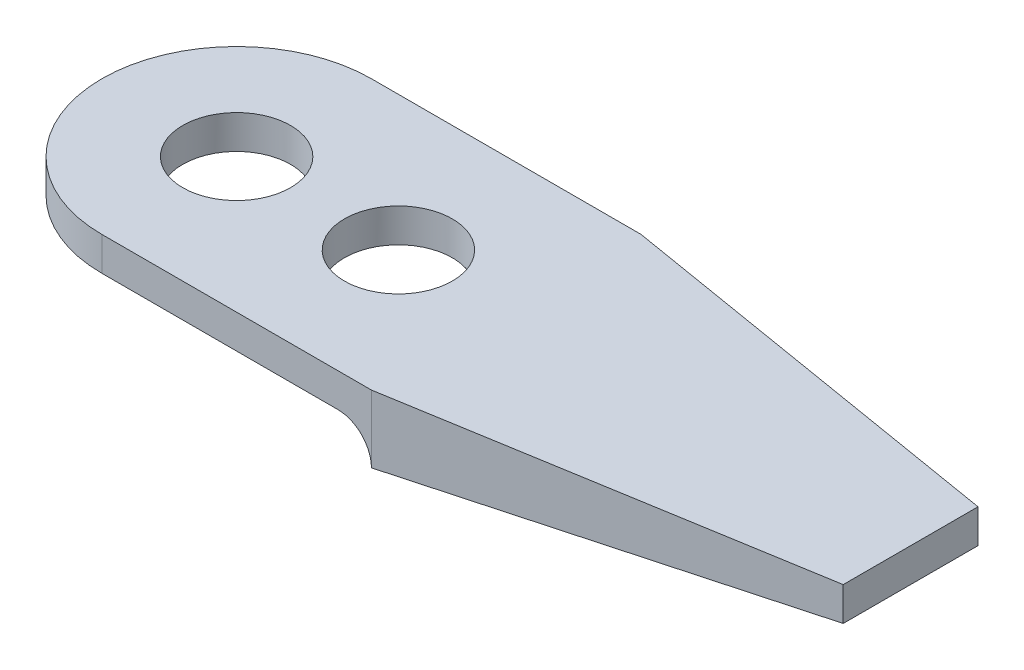
from build123d import *

# Parameters (mm, degrees)
BOSS_EXTRUDE1_DEPTH = 6.35
CUT_EXTRUDE1_DEPTH  = 12.7
FILLET1_R           = 6.35
FILLET2_R           = 1.5875
SKETCH3_R           = 2.54
CUT_EXTRUDE2_DEPTH  = 12.7


with BuildPart() as part:
    # Sketch1 → Boss-Extrude1 (new, symmetric)
    with BuildSketch(Plane.XY):
        Polygon((-19.05, 0), (19.05, 0), (19.05, -1.5875), (0, -3.175), (0, -1.5875), (-19.05, -1.5875), align=None)
    extrude(amount=BOSS_EXTRUDE1_DEPTH, both=True)

    # Sketch2 → Cut-Extrude1 (cut)
    with BuildSketch(Plane(origin=(0, 0, 0), x_dir=(1, 0, 0), z_dir=(0, 1, 0))):
        Polygon((0, 6.35), (19.05, 3.175), (19.05, 6.35), align=None)
    cut_extrude1 = extrude(amount=-CUT_EXTRUDE1_DEPTH, mode=Mode.SUBTRACT)

    # Mirror1: Cut-Extrude1 across plane
    add(cut_extrude1.mirror(Plane.XY), mode=Mode.SUBTRACT)

    # Fillet1
    fillet1_edges = [part.edges().sort_by_distance(p)[0] for p in [
        (-19.05, -0.79375, -6.35),
        (-19.05, -0.79375, 6.35),
    ]]
    fillet(fillet1_edges, radius=FILLET1_R - 0.0001)  # a hair under: the kernel refuses the full size

    # Fillet2
    fillet2_edges = [part.edges().sort_by_distance(p)[0] for p in [
        (0, -1.5875, 0),
    ]]
    fillet(fillet2_edges, radius=FILLET2_R - 0.0001)  # a hair under: the kernel refuses the full size

    # Sketch3 → Cut-Extrude2 (cut)
    with BuildSketch(Plane(origin=(0, 0, 0), x_dir=(1, 0, 0), z_dir=(0, 1, 0))):
        with Locations(Location((-12.7, 0, 0), (0, 0, 270))):
            Circle(SKETCH3_R)
        with Locations(Location((-5.08, 0, 0), (0, 0, 270))):
            Circle(SKETCH3_R)
    extrude(amount=-CUT_EXTRUDE2_DEPTH, mode=Mode.SUBTRACT)


solid = part.part
